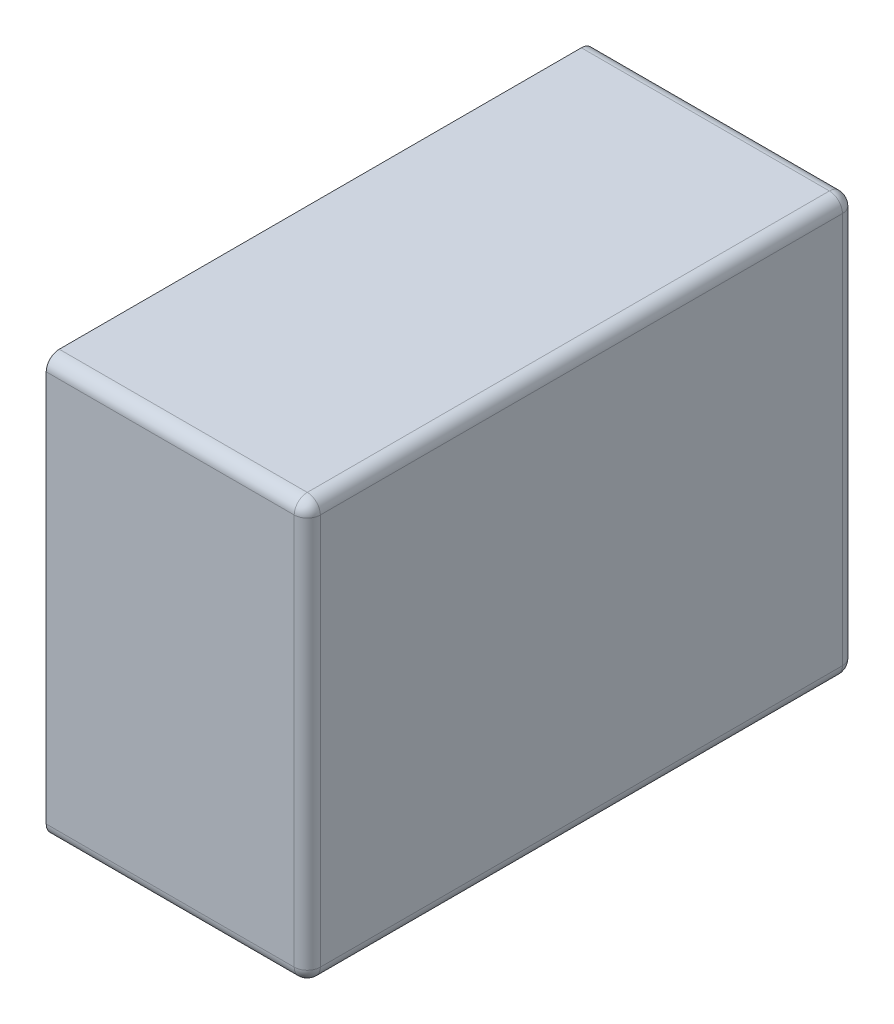
from build123d import *

# Parameters (mm, degrees)
SKETCH3_W           = 126
SKETCH3_H           = 96
BOSS_EXTRUDE3_DEPTH = 60
SKETCH5_W           = 124
SKETCH5_H           = 94
BOSS_EXTRUDE4_DEPTH = 1
SKETCH6_W           = 122
SKETCH6_H           = 92
CUT_EXTRUDE1_DEPTH  = 55
FILLET11_R          = 6
FILLET12_R          = 6
FILLET13_R          = 6
FILLET14_R          = 6
FILLET15_R          = 6
FILLET16_R          = 6
FILLET17_R          = 6
FILLET18_R          = 6
FILLET19_R          = 3
FILLET20_R          = 3
FILLET21_R          = 3
FILLET22_R          = 3
SKETCH8_R           = 3.5
CUT_EXTRUDE2_DEPTH  = 146.87666023
SKETCH9_R           = 6
CUT_EXTRUDE3_DEPTH  = 146.87666023
SKETCH10_R          = 6
CUT_EXTRUDE4_DEPTH  = 146.87666023


with BuildPart() as part:
    # Sketch3 → Boss-Extrude3 (new body)
    with BuildSketch(Plane(origin=(0, 0, 0), x_dir=(0, 0, -1), z_dir=(1, 0, 0))):
        Rectangle(SKETCH3_W, SKETCH3_H)
    extrude(amount=BOSS_EXTRUDE3_DEPTH)

    # Sketch5 → Boss-Extrude4 (add)
    with BuildSketch(Plane.ZY):
        Rectangle(SKETCH5_W, SKETCH5_H)
    extrude(amount=BOSS_EXTRUDE4_DEPTH)

    # Sketch6 → Cut-Extrude1 (cut)
    with BuildSketch(Plane.ZY.offset(1)):
        Rectangle(SKETCH6_W, SKETCH6_H)
    extrude(amount=-CUT_EXTRUDE1_DEPTH, mode=Mode.SUBTRACT)

    # Fillet11
    fillet11_edges = [part.edges().sort_by_distance(p)[0] for p in [
        (26.5, -46, 61),
    ]]
    fillet(fillet11_edges, radius=FILLET11_R)

    # Fillet12
    fillet12_edges = [part.edges().sort_by_distance(p)[0] for p in [
        (-0.5, -47, 62),
    ]]
    fillet(fillet12_edges, radius=FILLET12_R)

    # Fillet13
    fillet13_edges = [part.edges().sort_by_distance(p)[0] for p in [
        (26.5, 46, 61),
    ]]
    fillet(fillet13_edges, radius=FILLET13_R)

    # Fillet14
    fillet14_edges = [part.edges().sort_by_distance(p)[0] for p in [
        (-0.5, 47, 62),
    ]]
    fillet(fillet14_edges, radius=FILLET14_R)

    # Fillet15
    fillet15_edges = [part.edges().sort_by_distance(p)[0] for p in [
        (26.5, 46, -61),
    ]]
    fillet(fillet15_edges, radius=FILLET15_R)

    # Fillet16
    fillet16_edges = [part.edges().sort_by_distance(p)[0] for p in [
        (-0.5, 47, -62),
    ]]
    fillet(fillet16_edges, radius=FILLET16_R)

    # Fillet17
    fillet17_edges = [part.edges().sort_by_distance(p)[0] for p in [
        (26.5, -46, -61),
    ]]
    fillet(fillet17_edges, radius=FILLET17_R)

    # Fillet18
    fillet18_edges = [part.edges().sort_by_distance(p)[0] for p in [
        (-0.5, -47, -62),
    ]]
    fillet(fillet18_edges, radius=FILLET18_R)

    # Fillet19
    fillet19_edges = [part.edges().sort_by_distance(p)[0] for p in [
        (30, -48, -63),
    ]]
    fillet(fillet19_edges, radius=FILLET19_R)

    # Fillet20
    fillet20_edges = [part.edges().sort_by_distance(p)[0] for p in [
        (30, 48, -63),
    ]]
    fillet(fillet20_edges, radius=FILLET20_R)

    # Fillet21
    fillet21_edges = [part.edges().sort_by_distance(p)[0] for p in [
        (60, -48, 1.5),
        (60, -47.121320344, -62.121320344),
        (60, 0, -63),
        (60, 47.121320344, -62.121320344),
        (60, 48, 1.5),
    ]]
    fillet(fillet21_edges, radius=FILLET21_R)

    # Fillet22
    fillet22_edges = [part.edges().sort_by_distance(p)[0] for p in [
        (28.5, -48, 63),
        (59.121320344, -47.121320344, 63),
        (60, 0, 63),
        (59.121320344, 47.121320344, 63),
        (28.5, 48, 63),
    ]]
    fillet(fillet22_edges, radius=FILLET22_R)

    # Sketch8 → Cut-Extrude2 (cut, through all)
    with BuildSketch(Plane.XY.offset(-61)):
        with Locations((20.5, -20)):
            Circle(SKETCH8_R)
    extrude(amount=-CUT_EXTRUDE2_DEPTH, mode=Mode.SUBTRACT)

    # Sketch9 → Cut-Extrude3 (cut, through all)
    with BuildSketch(Plane.XY.offset(-61)):
        with Locations((20.5, 0)):
            Circle(SKETCH9_R)
    extrude(amount=-CUT_EXTRUDE3_DEPTH, mode=Mode.SUBTRACT)

    # Sketch10 → Cut-Extrude4 (cut, through all)
    with BuildSketch(Plane.XY.offset(-61)):
        with Locations((20.5, 20)):
            Circle(SKETCH10_R)
    extrude(amount=-CUT_EXTRUDE4_DEPTH, mode=Mode.SUBTRACT)


solid = part.part
